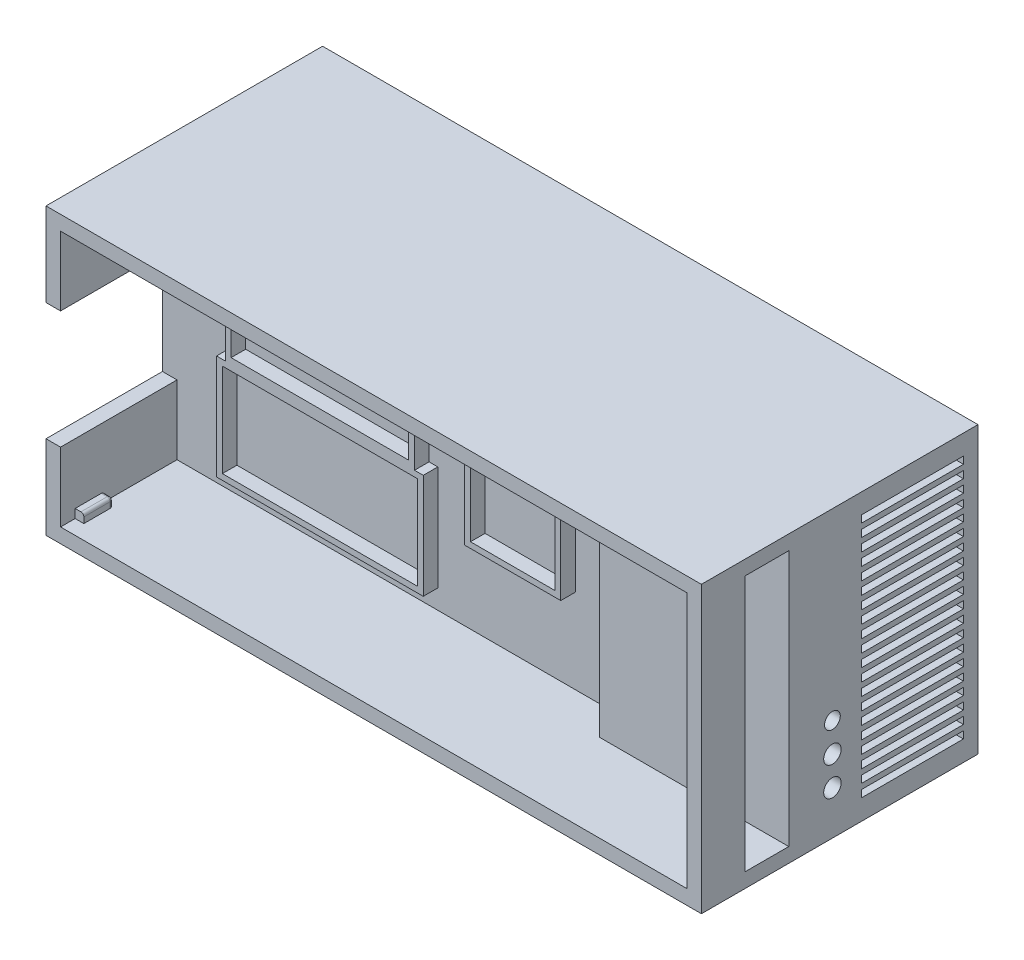
from build123d import *

# Parameters (mm, degrees)
BOSS_EXTRUDE1_DEPTH      = 5
SKETCH3_W                = 220
SKETCH3_H                = 88
BOSS_EXTRUDE3_DEPTH      = 5
SKETCH4_W                = 220.109500083
SKETCH4_H                = 50
BOSS_EXTRUDE4_DEPTH      = 5
SKETCH5_W                = 220.109500083
SKETCH5_H                = 93
BOSS_EXTRUDE5_DEPTH      = 5
BOSS_EXTRUDE6_DEPTH      = 5
BOSS_EXTRUDE6_DEPTH_BACK = 3.518054706
SKETCH6_W                = 220.109500083
SKETCH6_H                = 55
SKETCH7_W                = 30
SKETCH7_H                = 88
CUT_EXTRUDE2_DEPTH       = 13
SKETCH9_W                = 11
SKETCH9_H                = 5
CUT_EXTRUDE3_DEPTH       = 5
FILLET1_R                = 5
FILLET2_R                = 2
SKETCH11_W               = 55
SKETCH11_H               = 98
BOSS_EXTRUDE7_DEPTH      = 5
SKETCH12_W               = 225.109500083
SKETCH12_H               = 98
SKETCH12_W_2             = 215.109500083
SKETCH12_H_2             = 88
BOSS_EXTRUDE8_DEPTH      = 40
SKETCH13_W               = 15
SKETCH13_H               = 88
CUT_EXTRUDE5_DEPTH       = 35
SKETCH14_W               = 65
SKETCH14_H               = 88
BOSS_EXTRUDE9_DEPTH      = 5
SKETCH15_W               = 31.181142747
SKETCH15_H               = 88
CUT_EXTRUDE6_DEPTH       = 15
FILLET3_R                = 10
FILLET4_R                = 10
FILLET5_R                = 10
SKETCH17_R               = 3
SKETCH17_R_2             = 2.701620851
CUT_EXTRUDE7_DEPTH       = 15
SKETCH20_R               = 3
CUT_EXTRUDE9_DEPTH       = 15
SKETCH21_W               = 40
SKETCH21_H               = 2.45580884
CUT_EXTRUDE10_DEPTH      = 15
SKETCH22_W               = 5
SKETCH22_H               = 84.15580884
BOSS_EXTRUDE11_DEPTH     = 5
SKETCH24_W               = 40
SKETCH24_H               = 40.5
CUT_EXTRUDE11_DEPTH      = 5
SKETCH25_W               = 65
SKETCH25_H               = 43
SKETCH25_W_2             = 61
SKETCH25_H_2             = 39
SKETCH25_W_3             = 71
SKETCH25_H_3             = 36
SKETCH25_W_4             = 67
SKETCH25_H_4             = 32
SKETCH25_W_5             = 33
SKETCH25_H_5             = 30
SKETCH25_W_6             = 29
SKETCH25_H_6             = 26
BOSS_EXTRUDE14_DEPTH     = 5
SKETCH26_W               = 3
SKETCH26_H               = 3
BOSS_EXTRUDE16_DEPTH     = 10
FILLET8_R                = 1
FILLET9_R                = 1


# Some blends are built 0.0001 mm under size
with BuildPart() as part:
    # Sketch1 → Boss-Extrude1 (new body)
    with BuildSketch(Plane.XY):
        Polygon((-73.907455013, -12.793025089), (-73.907455013, -55.793025089), (146.092544987, -55.793025089), (146.092544987, 32.206974911), (-73.907455013, 32.206974911), (-73.907455013, 29.206974911), (-43.907455013, 29.206974911), (-43.907455013, -12.793025089), align=None)
    extrude(amount=BOSS_EXTRUDE1_DEPTH)

    # Sketch3 → Boss-Extrude3 (add)
    with BuildSketch(Plane.XY.offset(5)):
        with Locations((36.092544987, -11.793025089)):
            Rectangle(SKETCH3_W, SKETCH3_H)
    extrude(amount=BOSS_EXTRUDE3_DEPTH)

    # Sketch4 → Boss-Extrude4 (add)
    with BuildSketch(Plane.XZ.offset(55.793025089)):
        with Locations((36.147295028, -15)):
            Rectangle(SKETCH4_W, SKETCH4_H)
    extrude(amount=BOSS_EXTRUDE4_DEPTH)

    # Sketch5 → Boss-Extrude5 (add)
    with BuildSketch(Plane(origin=(0, 0, -40), x_dir=(-1, 0, 0), z_dir=(0, 0, -1))):
        with Locations((-36.147295028, -14.293025089)):
            Rectangle(SKETCH5_W, SKETCH5_H)
    extrude(amount=BOSS_EXTRUDE5_DEPTH)

    # Sketch6 → Boss-Extrude6 (add, two sides: drawn at the far end of the back side and taken through both)
    with BuildSketch(Plane(origin=(0, 32.206974911, 0), x_dir=(1, 0, 0), z_dir=(0, 1, 0)).offset(-BOSS_EXTRUDE6_DEPTH_BACK)):
        with Locations((36.147295028, 17.5)):
            Rectangle(SKETCH6_W, SKETCH6_H)
    extrude(amount=BOSS_EXTRUDE6_DEPTH + BOSS_EXTRUDE6_DEPTH_BACK)

    # Sketch7 → Cut-Extrude2 (cut)
    with BuildSketch(Plane.XY.offset(10)):
        with Locations((131.092544987, -11.793025089)):
            Rectangle(SKETCH7_W, SKETCH7_H)
    extrude(amount=-CUT_EXTRUDE2_DEPTH, mode=Mode.SUBTRACT)

    # Sketch9 → Cut-Extrude3 (cut)
    with BuildSketch(Plane.XZ.offset(60.793025089)):
        with Locations((-63.407455013, -12.5)):
            Rectangle(SKETCH9_W, SKETCH9_H)
        with Locations((-63.407455013, -22.5)):
            Rectangle(SKETCH9_W, SKETCH9_H)
    extrude(amount=-CUT_EXTRUDE3_DEPTH, mode=Mode.SUBTRACT)

    # Fillet1
    fillet1_edges = [part.edges().sort_by_distance(p)[0] for p in [
        (-58.907455013, -12.793025089, 0),
        (-43.907455013, 7.947947558, 0),
    ]]
    fillet(fillet1_edges, radius=FILLET1_R - 0.0001)  # a hair under: the kernel refuses the full size

    # Fillet2
    fillet2_edges = [part.edges().sort_by_distance(p)[0] for p in [
        (-68.907455013, -55.793025089, -12.5),
        (-63.407455013, -55.793025089, -10),
        (-57.907455013, -55.793025089, -12.5),
        (-63.407455013, -55.793025089, -15),
        (-68.907455013, -55.793025089, -22.5),
        (-63.407455013, -55.793025089, -20),
        (-57.907455013, -55.793025089, -22.5),
        (-63.407455013, -55.793025089, -25),
    ]]
    fillet(fillet2_edges, radius=FILLET2_R)

    # Sketch11 → Boss-Extrude7 (add)
    with BuildSketch(Plane(origin=(146.20204507, 0, 0), x_dir=(0, 0, -1), z_dir=(1, 0, 0))):
        with Locations((17.5, -11.793025089)):
            Rectangle(SKETCH11_W, SKETCH11_H)
    extrude(amount=BOSS_EXTRUDE7_DEPTH)

    # Sketch12 → Boss-Extrude8 (add)
    with BuildSketch(Plane.XY.offset(10)):
        with Locations((38.647295028, -11.793025089)):
            Rectangle(SKETCH12_W, SKETCH12_H)
        with Locations((38.647295028, -11.793025089)):
            Rectangle(SKETCH12_W_2, SKETCH12_H_2, mode=Mode.SUBTRACT)
    extrude(amount=BOSS_EXTRUDE8_DEPTH)

    # Sketch13 → Cut-Extrude5 (cut)
    with BuildSketch(Plane.ZY.offset(-146.20204507)):
        with Locations((27.5, -11.793025089)):
            Rectangle(SKETCH13_W, SKETCH13_H)
    extrude(amount=-CUT_EXTRUDE5_DEPTH, mode=Mode.SUBTRACT)

    # Sketch14 → Boss-Extrude9 (add)
    with BuildSketch(Plane.XY.offset(20)):
        with Locations((118.70204507, -11.793025089)):
            Rectangle(SKETCH14_W, SKETCH14_H)
    extrude(amount=-BOSS_EXTRUDE9_DEPTH)

    # Sketch15 → Cut-Extrude6 (cut)
    with BuildSketch(Plane.XY.offset(10)):
        with Locations((101.792616444, -11.793025089)):
            Rectangle(SKETCH15_W, SKETCH15_H)
    extrude(amount=-CUT_EXTRUDE6_DEPTH, mode=Mode.SUBTRACT)

    # Fillet3
    # the kernel refuses this fillet: 10 mm, written as the material it adds along each edge
    with BuildSketch(Plane(origin=(146.20204507, 32.206974911, 15), x_dir=(0, 0, -1), z_dir=(0, -1, 0))) as fillet3_piece_1:
        with BuildLine():
            CenterArc((FILLET3_R, -FILLET3_R), FILLET3_R, 90, 90)
            Line((0, -FILLET3_R), (0, 0))
            Line((0, 0), (FILLET3_R, 0))
        make_face()
    extrude(amount=88)

    # Fillet4
    fillet4_edges = [part.edges().sort_by_distance(p)[0] for p in [
        (86.20204507, -11.793025089, 10),
    ]]
    fillet(fillet4_edges, radius=FILLET4_R)

    # Fillet5
    # the kernel refuses this fillet: 10 mm, written as the material it takes off along each edge
    with BuildSketch(Plane(origin=(86.20204507, -55.793025089, 15), x_dir=(0, 0, 1), z_dir=(0, 1, 0))) as fillet5_piece_1:
        with BuildLine():
            CenterArc((10, 8.660254038), FILLET5_R, 180, 60)
            Line((0, 8.660254038), (0, 0))
            Line((0, 0), (5, 0))
        make_face()
    extrude(amount=88, mode=Mode.SUBTRACT)

    # Sketch17 → Cut-Extrude7 (cut)
    with BuildSketch(Plane(origin=(151.20204507, 0, 0), x_dir=(0, 0, -1), z_dir=(1, 0, 0))):
        with Locations((-5, -45.793025089)):
            Circle(SKETCH17_R)
        with Locations((-5, -35.793025089)):
            Circle(SKETCH17_R)
        with Locations((-5, -25.793025089)):
            Circle(SKETCH17_R_2)
    extrude(amount=-CUT_EXTRUDE7_DEPTH, mode=Mode.SUBTRACT)

    # Sketch20 → Cut-Extrude9 (cut)
    with BuildSketch(Plane(origin=(0, 0, -45), x_dir=(-1, 0, 0), z_dir=(0, 0, -1))):
        with Locations((38.907455013, -5.793025089)):
            Circle(SKETCH20_R)
    extrude(amount=-CUT_EXTRUDE9_DEPTH, mode=Mode.SUBTRACT)

    # Sketch21 → Cut-Extrude10 (cut)
    with BuildSketch(Plane.ZY.offset(-146.20204507)):
        with Locations((-20, -52.565120669)):
            Rectangle(SKETCH21_W, SKETCH21_H)
        with Locations((-20, -48.265120669)):
            Rectangle(SKETCH21_W, SKETCH21_H)
        with Locations((-20, -43.965120669)):
            Rectangle(SKETCH21_W, SKETCH21_H)
        with Locations((-20, -39.665120669)):
            Rectangle(SKETCH21_W, SKETCH21_H)
        with Locations((-20, -35.365120669)):
            Rectangle(SKETCH21_W, SKETCH21_H)
        with Locations((-20, -31.065120669)):
            Rectangle(SKETCH21_W, SKETCH21_H)
        with Locations((-20, -26.765120669)):
            Rectangle(SKETCH21_W, SKETCH21_H)
        with Locations((-20, -22.465120669)):
            Rectangle(SKETCH21_W, SKETCH21_H)
        with Locations((-20, -18.165120669)):
            Rectangle(SKETCH21_W, SKETCH21_H)
        with Locations((-20, -13.865120669)):
            Rectangle(SKETCH21_W, SKETCH21_H)
        with Locations((-20, -9.565120669)):
            Rectangle(SKETCH21_W, SKETCH21_H)
        with Locations((-20, -5.265120669)):
            Rectangle(SKETCH21_W, SKETCH21_H)
        with Locations((-20, -0.965120669)):
            Rectangle(SKETCH21_W, SKETCH21_H)
        with Locations((-20, 3.334879331)):
            Rectangle(SKETCH21_W, SKETCH21_H)
        with Locations((-20, 7.634879331)):
            Rectangle(SKETCH21_W, SKETCH21_H)
        with Locations((-20, 11.934879331)):
            Rectangle(SKETCH21_W, SKETCH21_H)
        with Locations((-20, 16.234879331)):
            Rectangle(SKETCH21_W, SKETCH21_H)
        with Locations((-20, 20.534879331)):
            Rectangle(SKETCH21_W, SKETCH21_H)
        with Locations((-20, 24.834879331)):
            Rectangle(SKETCH21_W, SKETCH21_H)
        with Locations((-20, 29.134879331)):
            Rectangle(SKETCH21_W, SKETCH21_H)
    extrude(amount=-CUT_EXTRUDE10_DEPTH, mode=Mode.SUBTRACT)

    # Sketch22 → Boss-Extrude11 (add)
    with BuildSketch(Plane(origin=(151.20204507, 0, 0), x_dir=(0, 0, -1), z_dir=(1, 0, 0))):
        with Locations((2.5, -11.715120669)):
            Rectangle(SKETCH22_W, SKETCH22_H)
    extrude(amount=-BOSS_EXTRUDE11_DEPTH)

    # Sketch24 → Cut-Extrude11 (cut)
    with BuildSketch(Plane(origin=(-68.907455013, 0, 0), x_dir=(0, 0, -1), z_dir=(1, 0, 0))):
        with Locations((-30, -11.793025089)):
            Rectangle(SKETCH24_W, SKETCH24_H)
    extrude(amount=-CUT_EXTRUDE11_DEPTH, mode=Mode.SUBTRACT)

    # Sketch25 → Boss-Extrude14 (add)
    # profile 1 of 3: a face of its own
    with BuildSketch(Plane.XY.offset(10)):
        with Locations((-14.834315786, 8.362068712)):
            Rectangle(SKETCH25_W, SKETCH25_H)
        with Locations((-14.834315786, 8.362068712)):
            Rectangle(SKETCH25_W_2, SKETCH25_H_2, mode=Mode.SUBTRACT)
    # profile 2 of 3: a face of its own
    with BuildSketch(Plane.XY.offset(10)):
        with Locations((-14.834315786, -31.137931288)):
            Rectangle(SKETCH25_W_3, SKETCH25_H_3)
        with Locations((-14.834315786, -31.137931288)):
            Rectangle(SKETCH25_W_4, SKETCH25_H_4, mode=Mode.SUBTRACT)
    # profile 3 of 3: a face of its own
    with BuildSketch(Plane.XY.offset(10)):
        with Locations((51.389036559, -11.793025089)):
            Rectangle(SKETCH25_W_5, SKETCH25_H_5)
        with Locations((51.389036559, -11.793025089)):
            Rectangle(SKETCH25_W_6, SKETCH25_H_6, mode=Mode.SUBTRACT)
    extrude(amount=BOSS_EXTRUDE14_DEPTH)

    # Sketch26 → Boss-Extrude16 (add)
    with BuildSketch(Plane.XY.offset(45)):
        with Locations((144.70204507, 30.706974911)):
            Rectangle(SKETCH26_W, SKETCH26_H)
        with Locations((-67.407455013, 30.706974911)):
            Rectangle(SKETCH26_W, SKETCH26_H)
        with Locations((-67.407455013, -54.293025089)):
            Rectangle(SKETCH26_W, SKETCH26_H)
        with Locations((144.70204507, -54.293025089)):
            Rectangle(SKETCH26_W, SKETCH26_H)
    extrude(amount=-BOSS_EXTRUDE16_DEPTH)

    # Fillet8
    fillet8_edges = [part.edges().sort_by_distance(p)[0] for p in [
        (-65.907455013, 30.706974911, 35),
        (-67.407455013, 29.206974911, 35),
        (-65.907455013, 29.206974911, 40),
    ]]
    fillet(fillet8_edges, radius=FILLET8_R)

    # Fillet9
    fillet9_edges = [part.edges().sort_by_distance(p)[0] for p in [
        (143.20204507, 30.706974911, 35),
        (143.20204507, 29.206974911, 40),
        (144.70204507, 29.206974911, 35),
        (-67.407455013, -52.793025089, 35),
        (-65.907455013, -54.293025089, 35),
        (-65.907455013, -52.793025089, 40),
        (143.20204507, -54.293025089, 35),
        (144.70204507, -52.793025089, 35),
        (143.20204507, -52.793025089, 40),
    ]]
    fillet(fillet9_edges, radius=FILLET9_R)


solid = part.part
